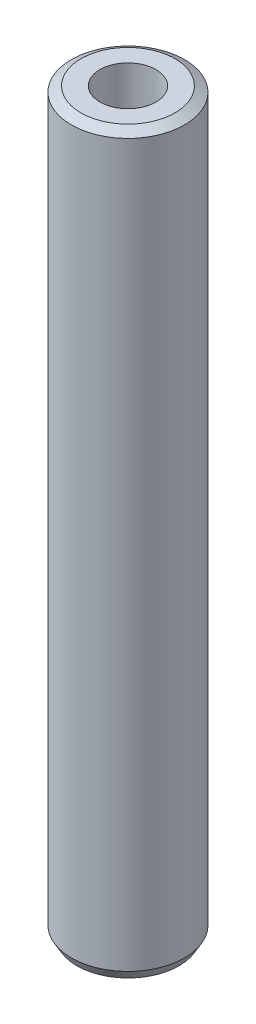
from build123d import *
from OCP.BRepFilletAPI import BRepFilletAPI_MakeChamfer

# Parameters (mm, degrees)
SKETCH1_R           = 40
BOSS_EXTRUDE1_DEPTH = 520.41809134
SKETCH2_R           = 19.831933085
CUT_EXTRUDE1_DEPTH  = 524.483514348
CHAMFER1_SIZE       = 3.928347677
CHAMFER1_SIZE2      = 6.804097766


with BuildPart() as part:
    # Sketch1 → Boss-Extrude1 (new body)
    with BuildSketch(Plane(origin=(0, 0, 0), x_dir=(1, 0, 0), z_dir=(0, 1, 0))):
        Circle(SKETCH1_R)
    extrude(amount=BOSS_EXTRUDE1_DEPTH)

    # Sketch2 → Cut-Extrude1 (cut, through all)
    with BuildSketch(Plane(origin=(0, 0, 0), x_dir=(1, 0, 0), z_dir=(0, 1, 0))):
        Circle(SKETCH2_R)
    extrude(amount=CUT_EXTRUDE1_DEPTH, mode=Mode.SUBTRACT)

    # Chamfer1: one chamfer whose edges measure the first distance from different faces: ONE call of the kernel's chamfer builder (chamfer() names one face for all edges)
    chamfer1_edges_1 = [part.edges().sort_by_distance(p)[0] for p in [
        (-40, 520.41809134, 0),
    ]]
    chamfer1_side_1 = [part.faces().sort_by_distance(p)[0] for p in [
        (-40, 260.20904567, 0),
    ]]
    chamfer1_edges_2 = [part.edges().sort_by_distance(p)[0] for p in [
        (-40, 0, 0),
    ]]
    chamfer1_side_2 = [part.faces().sort_by_distance(p)[0] for p in [
        (-38.86862915, 0, 0),
    ]]
    chamfer1 = BRepFilletAPI_MakeChamfer(part.part.solid().wrapped)
    for e in chamfer1_edges_1:
        chamfer1.Add(CHAMFER1_SIZE, CHAMFER1_SIZE2, e.wrapped, chamfer1_side_1[0].wrapped)  # the first distance lies on this face
    for e in chamfer1_edges_2:
        chamfer1.Add(CHAMFER1_SIZE, CHAMFER1_SIZE2, e.wrapped, chamfer1_side_2[0].wrapped)  # the first distance lies on this face
    add(Compound.cast(chamfer1.Shape()), mode=Mode.REPLACE)


solid = part.part
